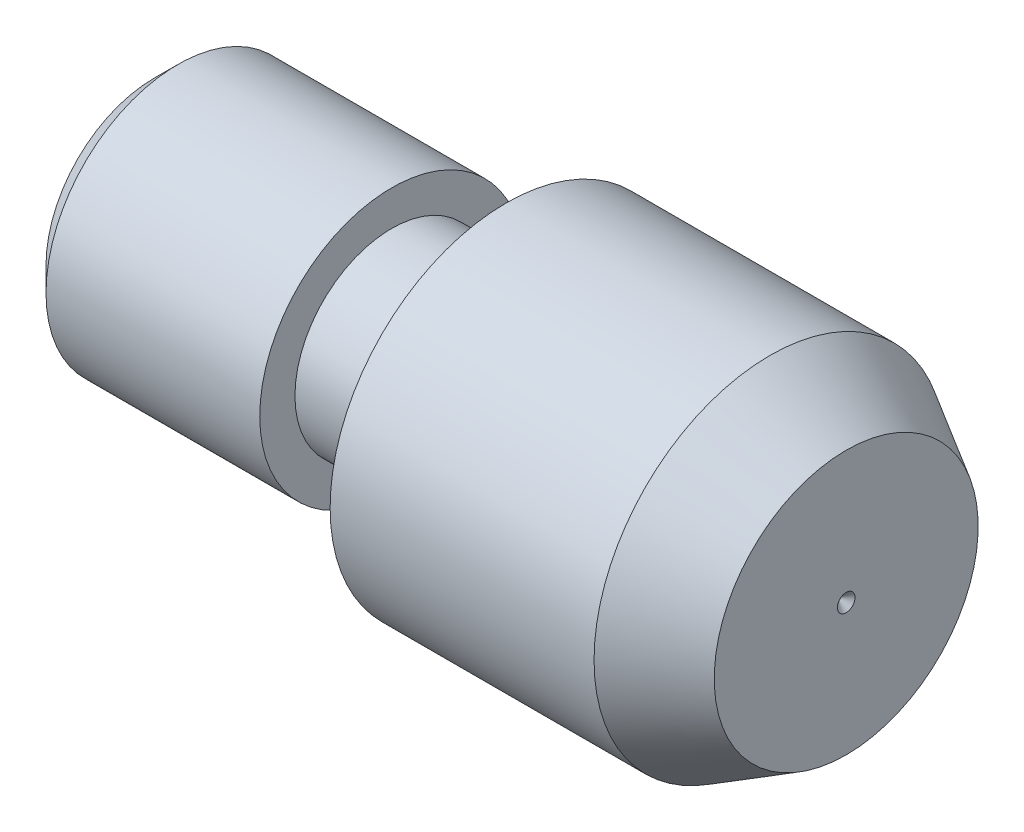
from build123d import *

# Parameters (mm, degrees)
CHAMFER5_SIZE = 0.2705


with BuildPart() as part:
    # Sketch1 → Revolve1 (revolve)
    with BuildSketch(Plane.XY):
        with BuildLine():
            Line((0, 0), (0, 1.5))
            Line((0, 1.5), (2.7, 1.5))
            Line((2.7, 1.5), (2.7, 1.1))
            Line((2.7, 1.1), (3.8, 1.1))
            ThreePointArc((3.8, 1.1), (3.941421356, 1.158578644), (4, 1.3))
            Line((4, 1.3), (4, 2))
            Line((4, 2), (7, 2))
            Line((7, 2), (7, 0))
            Line((7, 0), (0, 0))
        make_face()
    revolve(axis=Axis((0, 0, 0), (1, 0, 0)))

    # Chamfer5
    chamfer5_edges = [part.edges().sort_by_distance(p)[0] for p in [
        (0, -1.5, 0),
    ]]
    chamfer(chamfer5_edges, length=CHAMFER5_SIZE)

    # Sketch5 → Revolve3 (revolve)
    with BuildSketch(Plane.XY):
        Polygon((7, 0), (7, 2), (7.866025404, 1.5), (7.866025404, 0), align=None)
    revolve(axis=Axis((0, 0, 0), (1, 0, 0)))

    # Sketch6 → Cut-Revolve3 (revolve, cut)
    with BuildSketch(Plane.XY):
        Polygon((7.866025404, 0.1), (7.866025404, 0), (7.766025404, 0), align=None)
    revolve(axis=Axis((0, 0, 0), (1, 0, 0)), mode=Mode.SUBTRACT)


solid = part.part
